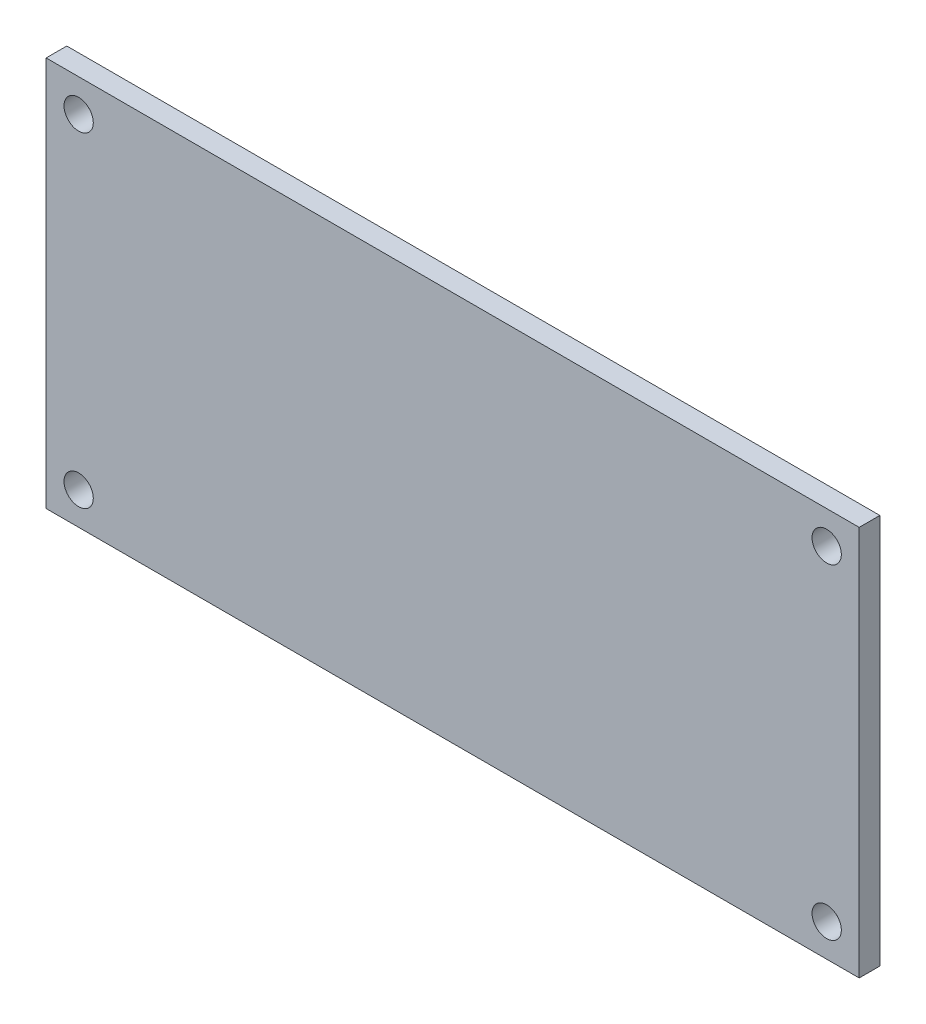
from build123d import *

# Parameters (mm, degrees)
SKETCH1_W           = 125
SKETCH1_H           = 60
BOSS_EXTRUDE1_DEPTH = 3.175
SKETCH2_R           = 2.25
CUT_EXTRUDE2_DEPTH  = 3.175


with BuildPart() as part:
    # Sketch1 → Boss-Extrude1 (new body)
    with BuildSketch(Plane.XY):
        Rectangle(SKETCH1_W, SKETCH1_H)
    extrude(amount=BOSS_EXTRUDE1_DEPTH)

    # Sketch2 → Cut-Extrude2 (cut)
    with BuildSketch(Plane.XY.offset(3.175)):
        with Locations((-57.5, 25)):
            Circle(SKETCH2_R)
        with Locations((-57.5, -25)):
            Circle(SKETCH2_R)
        with Locations((57.5, -25)):
            Circle(SKETCH2_R)
        with Locations((57.5, 25)):
            Circle(SKETCH2_R)
    extrude(amount=-CUT_EXTRUDE2_DEPTH, mode=Mode.SUBTRACT)


solid = part.part
